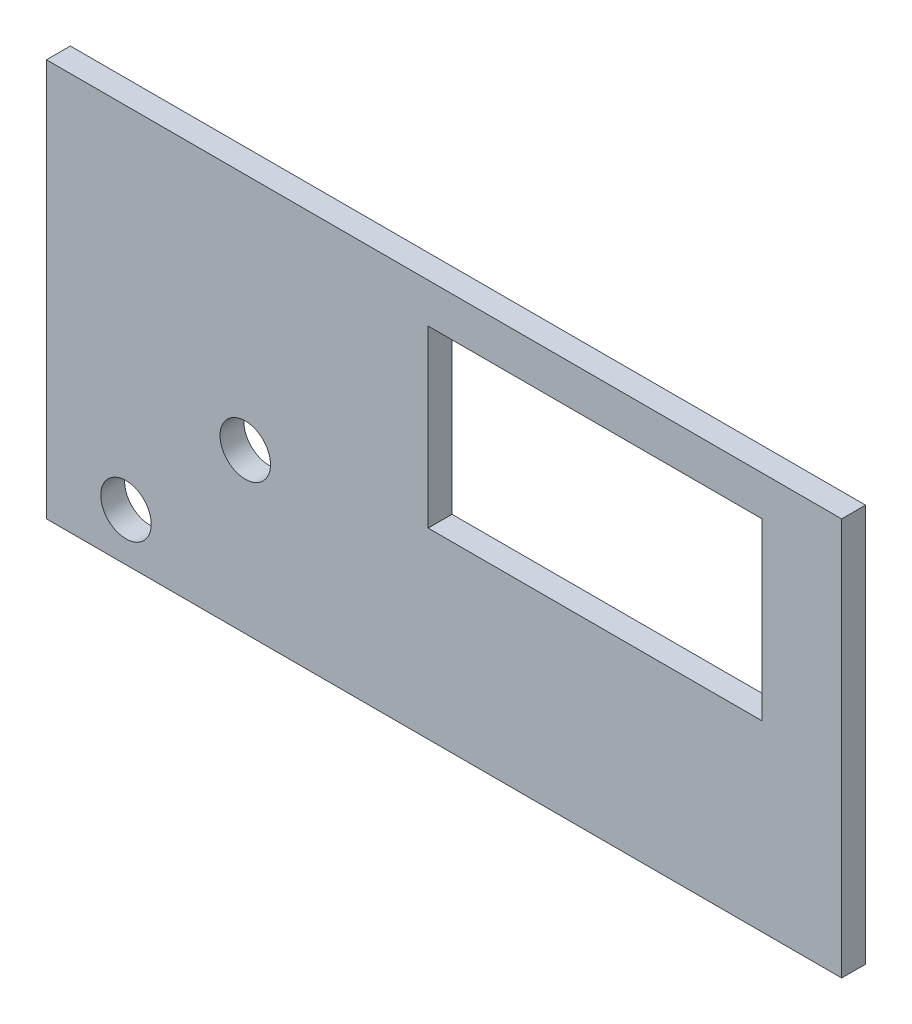
from build123d import *

# Parameters (mm, degrees)
SKETCH1_W           = 100
SKETCH1_H           = 50
BOSS_EXTRUDE1_DEPTH = 3
SKETCH2_R           = 3.175
SKETCH2_W           = 42
SKETCH2_H           = 22
CUT_EXTRUDE1_DEPTH  = 112.843640856


with BuildPart() as part:
    # Sketch1 → Boss-Extrude1 (new body)
    with BuildSketch(Plane.XY):
        with Locations((50, -25)):
            Rectangle(SKETCH1_W, SKETCH1_H)
    extrude(amount=BOSS_EXTRUDE1_DEPTH)

    # Sketch2 → Cut-Extrude1 (cut, through all)
    with BuildSketch(Plane.XY.offset(3)):
        with Locations((25, -30)):
            Circle(SKETCH2_R)
        with Locations((10, -44)):
            Circle(SKETCH2_R)
        with Locations((69, -16)):
            Rectangle(SKETCH2_W, SKETCH2_H)
    extrude(amount=-CUT_EXTRUDE1_DEPTH, mode=Mode.SUBTRACT)


solid = part.part
